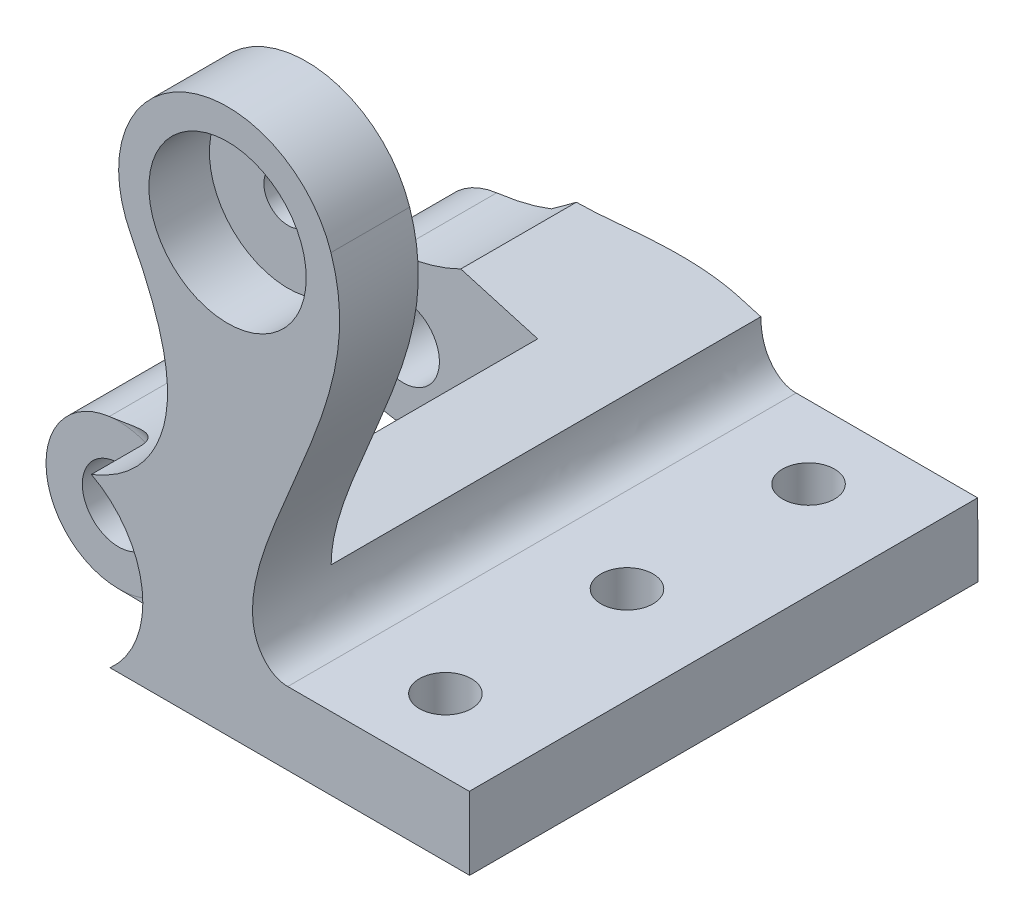
from build123d import *

# Parameters (mm, degrees)
SKETCH1_R           = 6.5
SKETCH1_R_2         = 3.000000000000001
SKETCH1_R_3         = 2.000000000000001
BOSS_EXTRUDE1_DEPTH = 21
CUT_EXTRUDE1_START  = -35.5
CUT_EXTRUDE1_DEPTH  = 35.5
CUT_EXTRUDE2_START  = -14.2
CUT_EXTRUDE2_DEPTH  = 15.3
SKETCH4_R           = 2.1500000000000012
SKETCH4_R_2         = 2.149999999999999
CUT_EXTRUDE3_DEPTH  = 15.3
SKETCH6_R           = 6.499999999999999
CUT_EXTRUDE4_DEPTH  = 5
SKETCH7_R           = 8.000000000000002
CUT_EXTRUDE5_DEPTH  = 6
CUT_EXTRUDE6_START  = -4
SKETCH8_R           = 8.000000000000002
CUT_EXTRUDE6_DEPTH  = 4
FILLET1_R           = 10
FILLET3_R           = 2


with BuildPart() as part:
    # Sketch1 → Boss-Extrude1 (new, symmetric)
    # profile 1 of 2: a face of its own
    with BuildSketch(Plane.XY):
        with BuildLine():
            add(Edge.make_bspline(
                [(8.542559375854681, 32.832786492130545), (10.686678203257555, 26.366975375458193), (5.856141786689584, 16.523631312439278), (0.5083868378802346, 2.514637421674764), (4.080331624706952, -3.187e-14), (4.9722311918748305, 5.6e-16)],
                knots=[0, 0, 0, 0, 0.5826135462254243, 0.9212236747100581, 1, 1, 1, 1], degree=3))
            Line((4.9722311918748305, 5.6e-16), (19.97223119187482, -6.1e-16))
            Line((19.97223119187482, -6.1e-16), (20.000000000000004, -6.000000000000001))
            Line((20.000000000000004, -6.000000000000001), (-15, -6.000000000000003))
            ThreePointArc((-15, -6.000000000000003), (-20.98762892620649, -0.38509718520825564), (-15.768606348517892, 5.950566719314891))
            add(Edge.make_bspline(
                [(-7.98954445714796, 25.856670497383014), (-4.906742308970248, 19.912131256682922), (-3.6628937282407366, 12.195881997757215), (-9.793673492034818, 6.722320325665471), (-15.768606348517892, 5.950566719314891)],
                knots=[0, 0, 0, 0, 0.5365412355207451, 1, 1, 1, 1], degree=3))
            ThreePointArc((-7.98954445714796, 25.856670497383014), (-3.4990005670363873, 38.29198378145294), (8.542559375854681, 32.832786492130545))
        make_face()
        with Locations((1.388e-14, 30)):
            Circle(SKETCH1_R, mode=Mode.SUBTRACT)
        with Locations(Location((-15, 0, 0), (0, 0, 180))):
            Circle(SKETCH1_R_2, mode=Mode.SUBTRACT)
    # profile 2 of 2: a face of its own
    with BuildSketch(Plane.XY):
        with Locations((1.388e-14, 30)):
            Circle(SKETCH1_R)
        with Locations(Location((1.388e-14, 30, 0), (0, 0, 180))):
            Circle(SKETCH1_R_3, mode=Mode.SUBTRACT)
    extrude(amount=BOSS_EXTRUDE1_DEPTH, both=True)

    # Sketch2 → Cut-Extrude1 (cut)
    with BuildSketch(Plane(origin=(0, 0, -21), x_dir=(-1, 0, 0), z_dir=(0, 0, -1)).offset(CUT_EXTRUDE1_START)):
        with BuildLine():
            Line((10.231277065568076, 7.523716250881215), (-2.057381883744481, 3.999999999999989))
            add(Edge.make_bspline(
                [(-8.542559375854681, 32.832786492130545), (-10.686678203257555, 26.366975375458193), (-6.407471523281442, 17.647094178971816), (-2.0529735437800074, 6.524226588369356), (-2.057381883744481, 3.999999999999989)],
                knots=[0, 0, 0, 0, 0.5826135462254243, 0.8160804851922084, 0.8160804851922084, 0.8160804851922084, 0.8160804851922084], degree=3))
            ThreePointArc((-8.542559375854681, 32.832786492130545), (3.499000567036403, 38.29198378145297), (7.98954445714796, 25.856670497383014))
            add(Edge.make_bspline(
                [(10.231277065568076, 7.523716250881215), (7.863619154783306, 8.719037669732709), (3.881869806613929, 13.55430618913155), (4.906742308970248, 19.912131256682922), (7.98954445714796, 25.856670497383014)],
                knots=[0.17604721488266967, 0.17604721488266967, 0.17604721488266967, 0.17604721488266967, 0.46345876447925494, 1, 1, 1, 1], degree=3))
        make_face()
    extrude(amount=CUT_EXTRUDE1_DEPTH, mode=Mode.SUBTRACT)

    # Sketch3 → Cut-Extrude2 (cut)
    with BuildSketch(Plane.XY.offset(21).offset(CUT_EXTRUDE2_START)):
        with BuildLine():
            Line((-15.000000000000002, -6.000000000000002), (-4.0341439002693456, -6.000000000000003))
            ThreePointArc((-4.0341439002693456, -6.000000000000003), (-2.748923532280786, 2.482161433528555), (-7.234360367683872, 9.795143750910501))
            add(Edge.make_bspline(
                [(-7.234360367683872, 9.795143750910501), (-8.872569061817323, 7.931489713842532), (-11.533359351024282, 6.497613392911335), (-15.768606348517892, 5.950566719314891)],
                knots=[0.6714837826850107, 0.6714837826850107, 0.6714837826850107, 0.6714837826850107, 1, 1, 1, 1], degree=3))
            ThreePointArc((-15.768606348517892, 5.950566719314891), (-20.98762892620649, -0.3850971852082583), (-15.000000000000002, -6.000000000000002))
        make_face()
    extrude(amount=-CUT_EXTRUDE2_DEPTH, mode=Mode.SUBTRACT)

    # Sketch4 → Cut-Extrude3 (cut)
    with BuildSketch(Plane(origin=(0, 0, 0), x_dir=(1, 1.3e-16, 0), z_dir=(-1.3e-16, 1, 0))):
        with Locations(Location((12, 0, 0), (0, 0, 180))):
            Circle(SKETCH4_R)
        with Locations(Location((11.999999999999996, 15, 0), (0, 0, 180))):
            Circle(SKETCH4_R_2)
        with Locations(Location((11.999999999999996, -15, 0), (0, 0, 180))):
            Circle(SKETCH4_R_2)
    extrude(amount=-CUT_EXTRUDE3_DEPTH, mode=Mode.SUBTRACT)

    # Sketch6 → Cut-Extrude4 (cut)
    with BuildSketch(Plane.XY.offset(21)):
        with Locations((1.388e-14, 30)):
            Circle(SKETCH6_R)
    extrude(amount=-CUT_EXTRUDE4_DEPTH, mode=Mode.SUBTRACT)

    # Sketch7 → Cut-Extrude5 (cut)
    with BuildSketch(Plane.XY.offset(21)):
        with Locations((-15, 0)):
            Circle(SKETCH7_R)
    extrude(amount=-CUT_EXTRUDE5_DEPTH, mode=Mode.SUBTRACT)

    # Sketch8 → Cut-Extrude6 (cut)
    with BuildSketch(Plane(origin=(0, 0, -21), x_dir=(-1, 0, 0), z_dir=(0, 0, -1)).offset(CUT_EXTRUDE6_START)):
        with Locations((15, 0)):
            Circle(SKETCH8_R)
    extrude(amount=CUT_EXTRUDE6_DEPTH, mode=Mode.SUBTRACT)

    # Fillet1
    # the kernel refuses this fillet: 10 mm, written as the material it takes off along each edge
    with BuildSketch(Plane(origin=(-15, 0, -21), x_dir=(-0.9934899400699477, -0.11391987965149795, 0), z_dir=(0.11391987965149795, -0.9934899400699477, 0))) as fillet1_piece_1:
        with BuildLine():
            CenterArc((16.000000000000007, -10.000000000000002), FILLET1_R, 90, 53.13010235415598)
            Line((8.000000000000004, -4), (8.000000000000004, 0))
            Line((8.000000000000004, 0), (16.000000000000007, 0))
        make_face()
    revolve(axis=Axis((-15, 0, -21), (0, 0, -1)), revolution_arc=359.6400000000001, mode=Mode.SUBTRACT)

    # Fillet3
    fillet3_edges = [part.edges().sort_by_distance(p)[0] for p in [
        (-7.0549828149653875, 0.9363236243440207, 15),
    ]]
    fillet(fillet3_edges, radius=FILLET3_R)


solid = part.part
